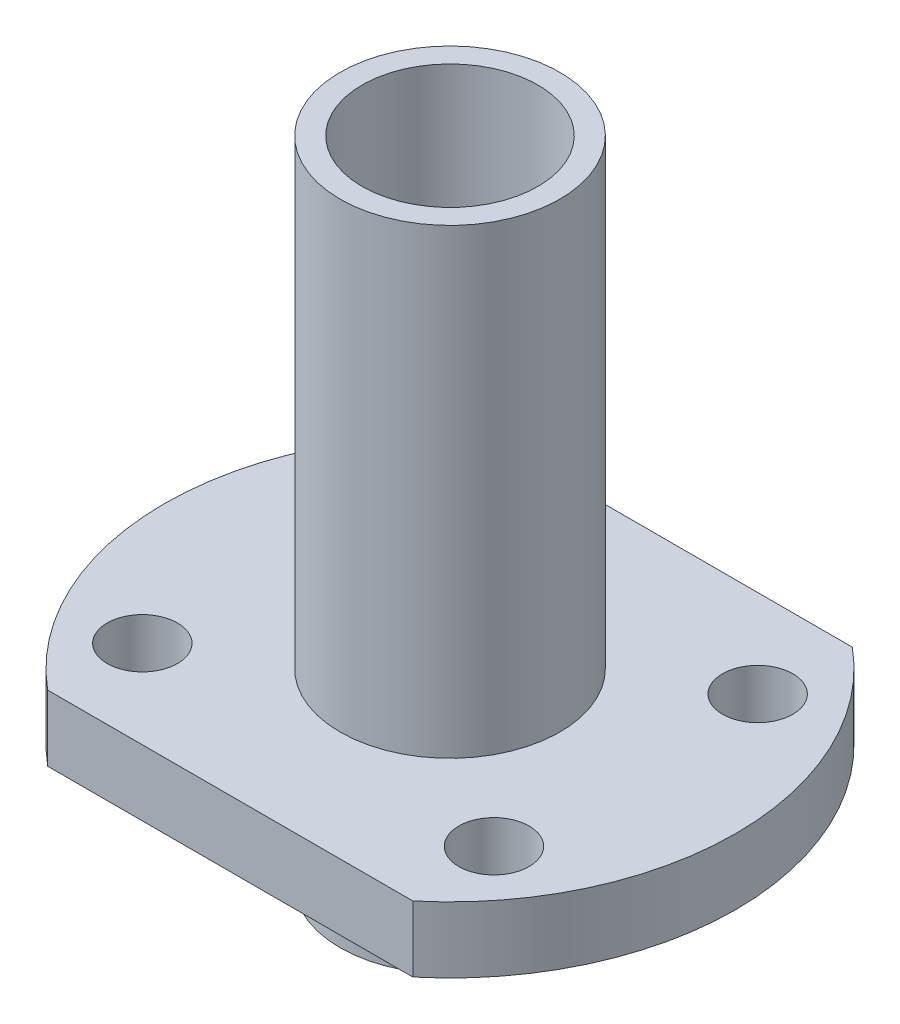
from build123d import *

# Parameters (mm, degrees)
SKETCH1_R                  = 5
BOSS_EXTRUDE1_DEPTH        = 29.5
BOSS_EXTRUDE2_DEPTH        = 3
SKETCH3_R                  = 4
CUT_EXTRUDE1_DEPTH         = 34.752777663
F_3_2_3_2_DIAMETER_HOLE1_D = 3.2


with BuildPart() as part:
    # Sketch1 → Boss-Extrude1 (new body)
    with BuildSketch(Plane(origin=(0, 0, 0), x_dir=(1, 0, 0), z_dir=(0, 1, 0))):
        Circle(SKETCH1_R)
    extrude(amount=BOSS_EXTRUDE1_DEPTH)

    # Sketch2 → Boss-Extrude2 (add)
    with BuildSketch(Plane(origin=(0, 5.5, 0), x_dir=(1, 0, 0), z_dir=(0, 1, 0))):
        with BuildLine():
            Line((8.306623863, 10), (-8.306623863, 10))
            ThreePointArc((-8.306623863, 10), (-11.768307238, 5.523309222), (-13, -2.7e-08))
            ThreePointArc((-13, -2.7e-08), (-11.768307226, -5.523309246), (-8.306623863, -10))
            Line((-8.306623863, -10), (8.306623863, -10))
            ThreePointArc((8.306623863, -10), (11.768307232, -5.523309234), (13, 0))
            ThreePointArc((13, 0), (11.768307232, 5.523309234), (8.306623863, 10))
        make_face()
    extrude(amount=BOSS_EXTRUDE2_DEPTH)

    # Sketch3 → Cut-Extrude1 (cut, through all)
    with BuildSketch(Plane(origin=(0, 29.5, 0), x_dir=(1, 0, 0), z_dir=(0, 1, 0))):
        Circle(SKETCH3_R)
    extrude(amount=-CUT_EXTRUDE1_DEPTH, mode=Mode.SUBTRACT)

    # Ø3.2 (3.2) Diameter Hole1 (through all)
    with Locations(Plane(origin=(8, 8.5, 6), x_dir=(0, 0, 1), z_dir=(0, 1, 0))):
        with Locations((0, 0), (-12, 0), (-12, -16), (0, -16)):
            Hole(F_3_2_3_2_DIAMETER_HOLE1_D / 2)


solid = part.part
